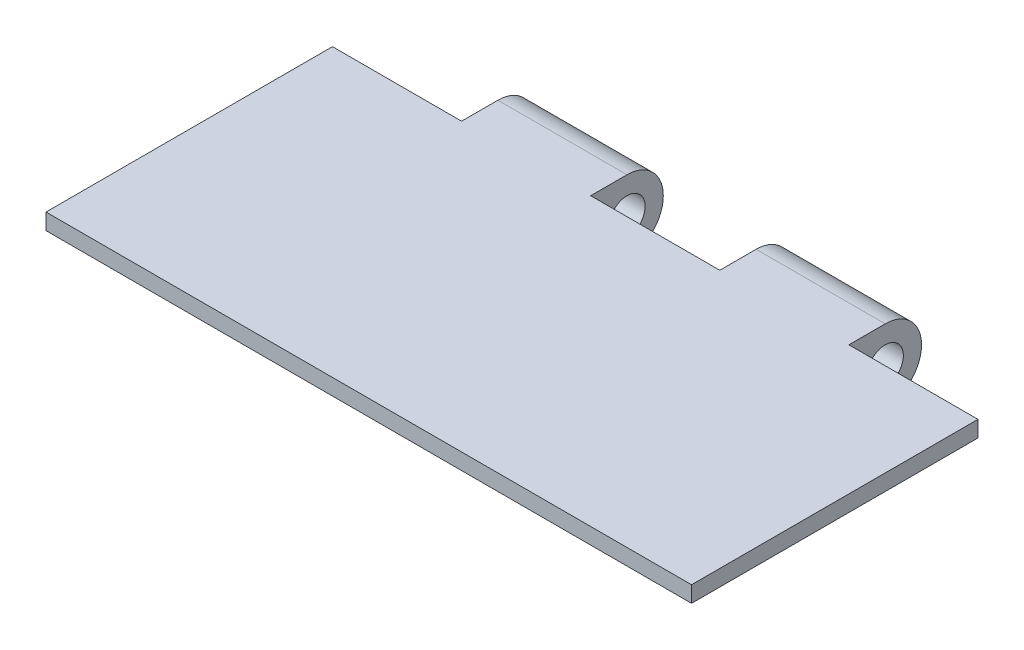
from build123d import *

# Parameters (mm, degrees)
BOSS_EXTRUDE1_DEPTH = 0.635
SKETCH2_W           = 5.08
SKETCH2_H           = 2.8575
BOSS_EXTRUDE2_DEPTH = 2.8575
FILLET1_R           = 1.42875
SKETCH3_R           = 0.714375
CUT_EXTRUDE1_DEPTH  = 30


with BuildPart() as part:
    # Sketch1 → Boss-Extrude1 (new body)
    with BuildSketch(Plane(origin=(0, 0, 0), x_dir=(1, 0, 0), z_dir=(0, 1, 0))):
        Polygon((12.849131833, 13.383236071), (7.769131833, 13.383236071), (7.769131833, 10.525736071), (2.689131833, 10.525736071), (2.689131833, -0.745513929), (28.089131833, -0.745513929), (28.089131833, 10.525736071), (23.009131833, 10.525736071), (23.009131833, 13.383236071), (17.929131833, 13.383236071), (17.929131833, 10.525736071), (12.849131833, 10.525736071), align=None)
    extrude(amount=BOSS_EXTRUDE1_DEPTH)

    # Sketch2 → Boss-Extrude2 (add)
    with BuildSketch(Plane(origin=(0, 0.635, 0), x_dir=(1, 0, 0), z_dir=(0, 1, 0))):
        with Locations((10.309131833, 11.954486071)):
            Rectangle(SKETCH2_W, SKETCH2_H)
        with Locations((20.469131833, 11.954486071)):
            Rectangle(SKETCH2_W, SKETCH2_H)
    extrude(amount=-BOSS_EXTRUDE2_DEPTH)

    # Fillet1
    fillet1_edges = [part.edges().sort_by_distance(p)[0] for p in [
        (10.309131833, -2.2225, -10.525736071),
        (20.469131833, -2.2225, -10.525736071),
        (20.469131833, -2.2225, -13.383236071),
        (10.309131833, -2.2225, -13.383236071),
        (10.309131833, 0.635, -13.383236071),
        (20.469131833, 0.635, -13.383236071),
    ]]
    fillet(fillet1_edges, radius=FILLET1_R - 0.0001)  # a hair under: the kernel refuses the full size

    # Sketch3 → Cut-Extrude1 (cut)
    with BuildSketch(Plane(origin=(23.009131833, 0, 0), x_dir=(0, 0, -1), z_dir=(1, 0, 0))):
        with Locations((11.954486071, -0.79375)):
            Circle(SKETCH3_R)
    extrude(amount=-CUT_EXTRUDE1_DEPTH, mode=Mode.SUBTRACT)


solid = part.part
